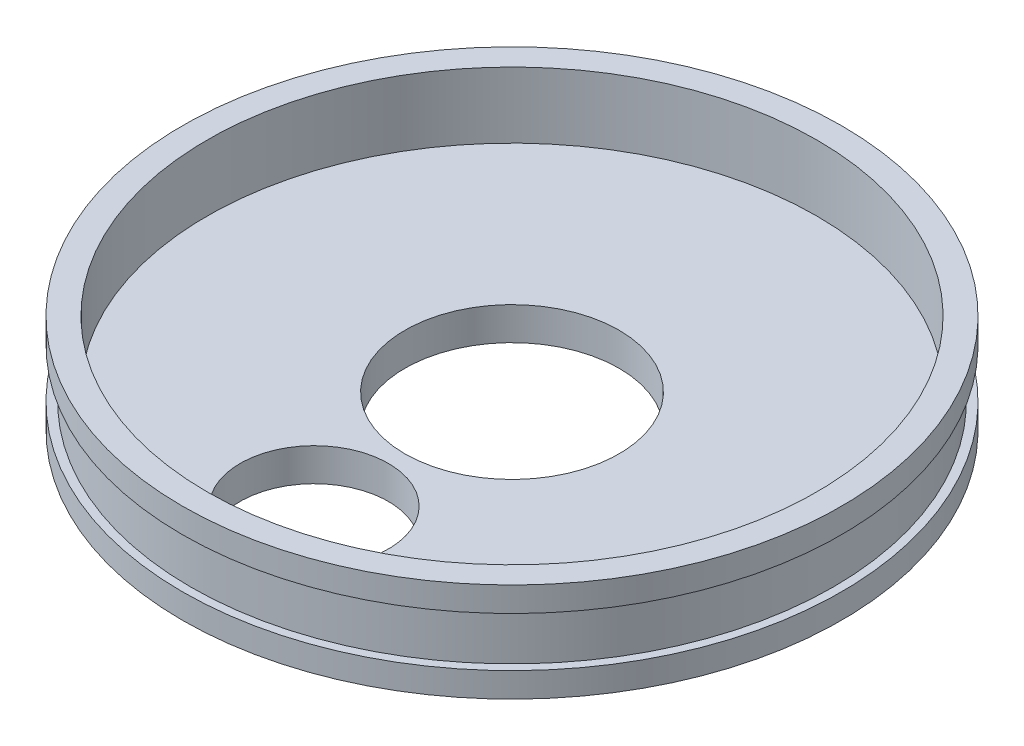
from build123d import *

# Parameters (mm, degrees)
SKETCH2_R      = 20
SKETCH2_R_2    = 4.5
SKETCH2_R_3    = 6.5
LIDBASE_DEPTH  = 2
SKETCH2_4_R    = 20
SKETCH2_4_R_2  = 18.5
LIDWALLS_DEPTH = 6
SKETCH3_W      = 0.5
SKETCH3_H      = 3


with BuildPart() as part:
    # Sketch2 → LidBase (new body)
    with BuildSketch(Plane(origin=(0, 0, 0), x_dir=(1, 0, 0), z_dir=(0, 1, 0))):
        Circle(SKETCH2_R)
        with Locations((0, -12)):
            Circle(SKETCH2_R_2, mode=Mode.SUBTRACT)
        Circle(SKETCH2_R_3, mode=Mode.SUBTRACT)
    extrude(amount=LIDBASE_DEPTH)

    # Sketch2<4> → LidWalls (add)
    with BuildSketch(Plane(origin=(0, 0, 0), x_dir=(1, 0, 0), z_dir=(0, 1, 0))):
        Circle(SKETCH2_4_R)
        Circle(SKETCH2_4_R_2, mode=Mode.SUBTRACT)
    extrude(amount=LIDWALLS_DEPTH)

    # Sketch3 → Beltgrooves (revolve, cut)
    with BuildSketch(Plane(origin=(0, 0, 0), x_dir=(0, 0, -1), z_dir=(1, 0, 0))):
        with Locations((19.75, 3)):
            Rectangle(SKETCH3_W, SKETCH3_H)
    revolve(axis=Axis((0, 0, 0), (0, 1, 0)), mode=Mode.SUBTRACT)


solid = part.part
